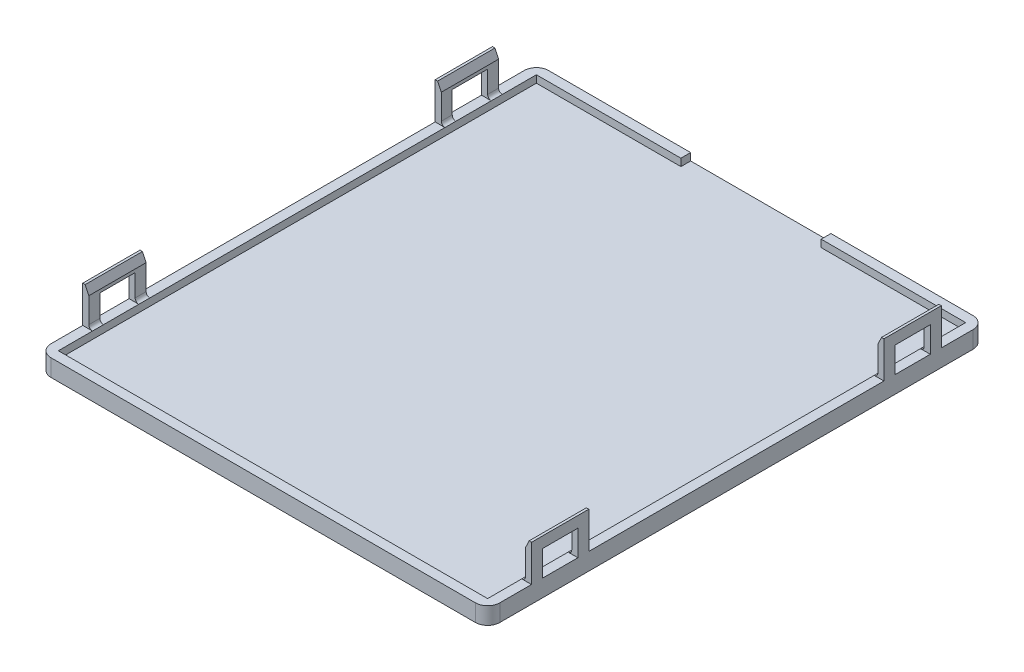
from build123d import *
from OCP.BRepFilletAPI import BRepFilletAPI_MakeChamfer

# Parameters (mm, degrees)
SKIZZE1_W                       = 73.6
SKIZZE1_H                       = 81.6
AUFSATZ_LINEAR_AUSTRAGEN1_DEPTH = 1.6
SKIZZE2_W                       = 73.6
SKIZZE2_H                       = 81.6
SKIZZE2_W_2                     = 70.4
SKIZZE2_H_2                     = 78.4
AUFSATZ_LINEAR_AUSTRAGEN2_DEPTH = 1.2
SKIZZE3_W                       = 23
SKIZZE3_H                       = 4
SCHNITT_LINEAR_AUSTRAGEN1_DEPTH = 1.6
AUFSATZ_LINEAR_AUSTRAGEN3_DEPTH = 1
VERRUNDUNG1_R                   = 0.6
FASE1_SIZE                      = 0.6
FASE1_SIZE2                     = 1.286704152
VERRUNDUNG2_R                   = 2


with BuildPart() as part:
    # Skizze1 → Aufsatz-Linear austragen1 (new body)
    with BuildSketch(Plane(origin=(0, -0.2, 0), x_dir=(1, 0, 0), z_dir=(0, 1, 0))):
        with Locations((35, 39)):
            Rectangle(SKIZZE1_W, SKIZZE1_H)
    extrude(amount=-AUFSATZ_LINEAR_AUSTRAGEN1_DEPTH)

    # Skizze2 → Aufsatz-Linear austragen2 (add)
    with BuildSketch(Plane(origin=(0, -0.2, 0), x_dir=(1, 0, 0), z_dir=(0, 1, 0))):
        with Locations((35, 39)):
            Rectangle(SKIZZE2_W, SKIZZE2_H)
        with Locations((35, 39)):
            Rectangle(SKIZZE2_W_2, SKIZZE2_H_2, mode=Mode.SUBTRACT)
    extrude(amount=AUFSATZ_LINEAR_AUSTRAGEN2_DEPTH)

    # Skizze3 → Schnitt-Linear austragen1 (cut)
    with BuildSketch(Plane.XY.offset(-78.2)):
        with Locations((35, 1.8)):
            Rectangle(SKIZZE3_W, SKIZZE3_H)
    extrude(amount=-SCHNITT_LINEAR_AUSTRAGEN1_DEPTH, mode=Mode.SUBTRACT)

    # Skizze4 → Aufsatz-Linear austragen3 (add)
    with BuildSketch(Plane(origin=(-1.8, 0, 0), x_dir=(0, 0, -1), z_dir=(1, 0, 0))):
        Polygon((63.2, 0), (63.2, 7), (72.6, 7), (72.6, 0), (70.8, 0), (70.8, 5.2), (65, 5.2), (65, 0), align=None)
        Polygon((14.8, 7), (5.4, 7), (5.4, 0), (7.2, 0), (7.2, 5.2), (13, 5.2), (13, 0), (14.8, 0), align=None)
    aufsatz_linear_austragen3 = extrude(amount=AUFSATZ_LINEAR_AUSTRAGEN3_DEPTH)

    # Spiegeln1: Aufsatz-Linear austragen3 across plane
    add(aufsatz_linear_austragen3.mirror(Plane(origin=(35, 0, 0), x_dir=(0, 0, 1), z_dir=(1, 0, 0))))

    # Verrundung1
    verrundung1_edges = [part.edges().sort_by_distance(p)[0] for p in [
        (70.8, 1, -64.1),
        (70.8, 1, -71.7),
        (70.8, 1, -13.9),
        (70.8, 1, -6.3),
        (-0.8, 1, -71.7),
        (-0.8, 1, -64.1),
        (-0.8, 1, -6.3),
        (-0.8, 1, -13.9),
    ]]
    fillet(verrundung1_edges, radius=VERRUNDUNG1_R - 0.0001)  # a hair under: the kernel refuses the full size

    # Fase1: one chamfer whose edges measure the first distance from different faces: ONE call of the kernel's chamfer builder (chamfer() names one face for all edges)
    fase1_edges_1 = [part.edges().sort_by_distance(p)[0] for p in [
        (70.8, 7, -67.9),
    ]]
    fase1_side_1 = [part.faces().sort_by_distance(p)[0] for p in [
        (71.3, 7, -67.9),
    ]]
    fase1_edges_2 = [part.edges().sort_by_distance(p)[0] for p in [
        (70.8, 7, -10.1),
    ]]
    fase1_side_2 = [part.faces().sort_by_distance(p)[0] for p in [
        (71.3, 7, -10.1),
    ]]
    fase1_edges_3 = [part.edges().sort_by_distance(p)[0] for p in [
        (-0.8, 7, -67.9),
    ]]
    fase1_side_3 = [part.faces().sort_by_distance(p)[0] for p in [
        (-1.3, 7, -67.9),
    ]]
    fase1_edges_4 = [part.edges().sort_by_distance(p)[0] for p in [
        (-0.8, 7, -10.1),
    ]]
    fase1_side_4 = [part.faces().sort_by_distance(p)[0] for p in [
        (-1.3, 7, -10.1),
    ]]
    fase1 = BRepFilletAPI_MakeChamfer(part.part.solid().wrapped)
    for e in fase1_edges_1:
        fase1.Add(FASE1_SIZE, FASE1_SIZE2, e.wrapped, fase1_side_1[0].wrapped)  # the first distance lies on this face
    for e in fase1_edges_2:
        fase1.Add(FASE1_SIZE, FASE1_SIZE2, e.wrapped, fase1_side_2[0].wrapped)  # the first distance lies on this face
    for e in fase1_edges_3:
        fase1.Add(FASE1_SIZE, FASE1_SIZE2, e.wrapped, fase1_side_3[0].wrapped)  # the first distance lies on this face
    for e in fase1_edges_4:
        fase1.Add(FASE1_SIZE, FASE1_SIZE2, e.wrapped, fase1_side_4[0].wrapped)  # the first distance lies on this face
    add(Compound.cast(fase1.Shape()), mode=Mode.REPLACE)

    # Verrundung2
    verrundung2_edges = [part.edges().sort_by_distance(p)[0] for p in [
        (-1.8, -0.4, -79.8),
        (71.8, -0.4, -79.8),
        (71.8, -0.4, 1.8),
        (-1.8, -0.4, 1.8),
    ]]
    fillet(verrundung2_edges, radius=VERRUNDUNG2_R)


solid = part.part
